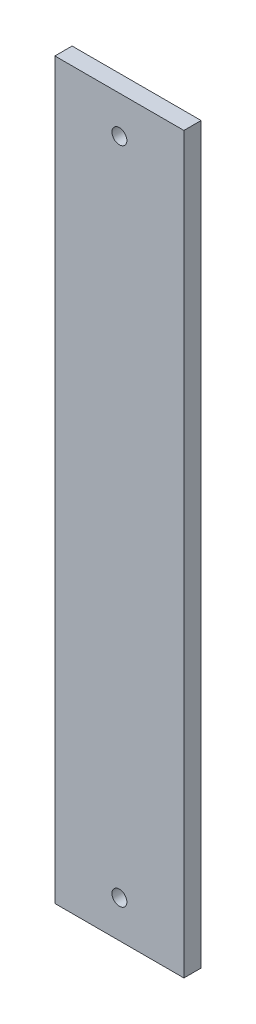
from build123d import *

# Parameters (mm, degrees)
ESBO_O1_W                = 45
ESBO_O1_H                = 256
ESBO_O1_R                = 2.6
RESSALTO_EXTRUS_O1_DEPTH = 6


with BuildPart() as part:
    # Esboço1 → Ressalto-extrusão1 (new body)
    with BuildSketch(Plane.XY):
        Rectangle(ESBO_O1_W, ESBO_O1_H)
        with Locations((0, 115)):
            Circle(ESBO_O1_R, mode=Mode.SUBTRACT)
        with Locations((0, -115)):
            Circle(ESBO_O1_R, mode=Mode.SUBTRACT)
    extrude(amount=RESSALTO_EXTRUS_O1_DEPTH)


solid = part.part
